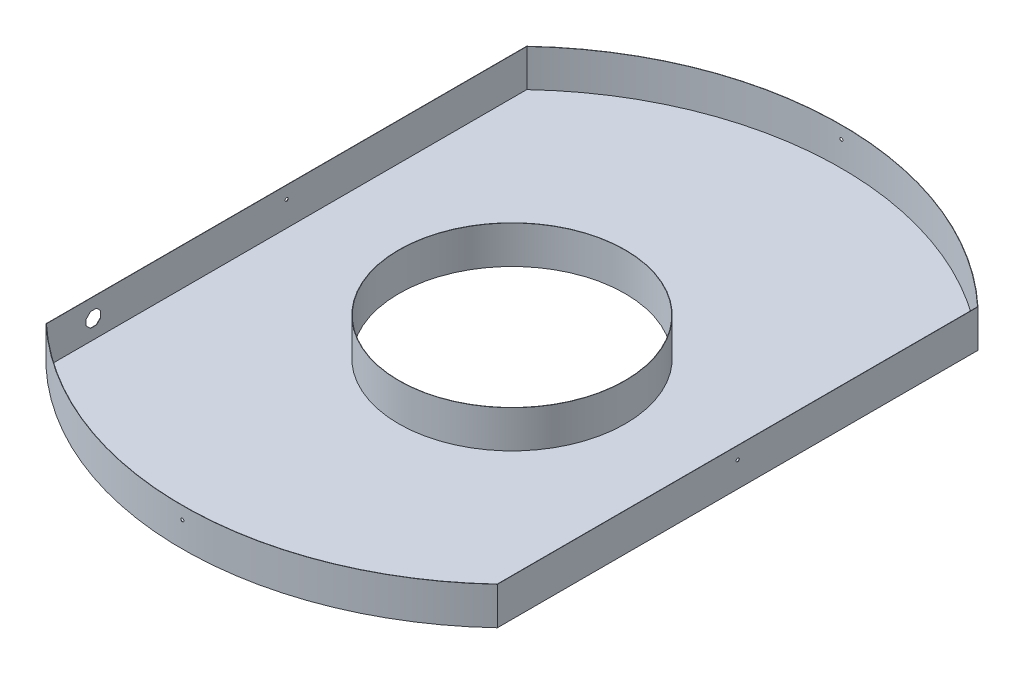
from build123d import *

# Parameters (mm, degrees)
SKETCH1_R                = 1750
BOSS_EXTRUDE1_DEPTH      = 500
SKETCH2_R                = 900
CUT_EXTRUDE2_DEPTH       = 300
CUT_EXTRUDE10_DEPTH      = 2525.876234591
CUT_EXTRUDE10_DEPTH_BACK = 2525.876234591
SKETCH10_W               = 4401.17604026
SKETCH10_H               = 5623.086471134
SKETCH10_W_2             = 2396.119838962
SKETCH10_H_2             = 4339.917258658
SKETCH3_R                = 600
CUT_EXTRUDE3_DEPTH       = 300
SHELL1_T                 = -1.5
SKETCH11_W               = 3093.35758239
SKETCH11_H               = 4860.990486612
CUT_EXTRUDE11_DEPTH      = 2142.92613567
SKETCH7_R                = 8.382
CUT_EXTRUDE6_DEPTH       = 900
CIRPATTERN1_COUNT        = 4
CUT_EXTRUDE13_DEPTH      = 10
SKETCH13_R               = 901.5
SKETCH13_R_2             = 601.5
CUT_EXTRUDE14_DEPTH      = 10


with BuildPart() as part:
    # Sketch1 → Boss-Extrude1 (new body)
    with BuildSketch(Plane(origin=(0, 0, 0), x_dir=(1, 0, 0), z_dir=(0, 1, 0))):
        Circle(SKETCH1_R)
    extrude(amount=BOSS_EXTRUDE1_DEPTH)

    # Sketch2 → Cut-Extrude2 (cut)
    with BuildSketch(Plane(origin=(0, 500, 0), x_dir=(1, 0, 0), z_dir=(0, 1, 0))):
        Circle(SKETCH2_R)
    extrude(amount=-CUT_EXTRUDE2_DEPTH, mode=Mode.SUBTRACT)

    # Sketch10 → Cut-Extrude10 (cut, two sides: drawn at the far end of the back side and taken through both)
    with BuildSketch(Plane(origin=(0, 500, 0), x_dir=(1, 0, 0), z_dir=(0, 1, 0)).offset(-CUT_EXTRUDE10_DEPTH_BACK)):
        Rectangle(SKETCH10_W, SKETCH10_H)
        Rectangle(SKETCH10_W_2, SKETCH10_H_2, mode=Mode.SUBTRACT)
    extrude(amount=CUT_EXTRUDE10_DEPTH + CUT_EXTRUDE10_DEPTH_BACK, mode=Mode.SUBTRACT)

    # Sketch3 → Cut-Extrude3 (cut)
    with BuildSketch(Plane.XZ):
        Circle(SKETCH3_R)
    extrude(amount=-CUT_EXTRUDE3_DEPTH, mode=Mode.SUBTRACT)

    # Shell1
    shell1_openings = [part.faces().sort_by_distance(p)[0] for p in [
        (1155.643660473, 500, 0),
    ]]
    offset(amount=SHELL1_T, openings=shell1_openings, kind=Kind.INTERSECTION)

    # Sketch11 → Cut-Extrude11 (cut, through all)
    with BuildSketch(Plane(origin=(0, 200, 0), x_dir=(1, 0, 0), z_dir=(0, 1, 0))):
        Rectangle(SKETCH11_W, SKETCH11_H)
    extrude(amount=CUT_EXTRUDE11_DEPTH, mode=Mode.SUBTRACT)

    # Sketch7 → Cut-Extrude6 (cut)
    with BuildSketch(Plane.XY.offset(2000)):
        with Locations((0, 133.897639423)):
            Circle(SKETCH7_R)
    cut_extrude6 = extrude(amount=-CUT_EXTRUDE6_DEPTH, mode=Mode.SUBTRACT)

    # CirPattern1: Cut-Extrude6 ×4 about axis
    cirpattern1_axis = Axis((0, 500, 0), (0, -1, 0))
    for i in range(1, CIRPATTERN1_COUNT):
        add(cut_extrude6.rotate(cirpattern1_axis, i * 360 / CIRPATTERN1_COUNT), mode=Mode.SUBTRACT)

    # Sketch12 → Cut-Extrude13 (cut)
    with BuildSketch(Plane.ZY.offset(1198.059919481)):
        Polygon((986.482270432, 84.275662181), (1009.035048281, 61.722884332), (1040.929492584, 61.722884332), (1063.482270432, 84.275662181), (1063.482270432, 116.170106484), (1040.929492584, 138.722884332), (1009.035048281, 138.722884332), (986.482270432, 116.170106484), align=None)
    extrude(amount=-CUT_EXTRUDE13_DEPTH, mode=Mode.SUBTRACT)

    # Sketch13 → Cut-Extrude14 (cut)
    with BuildSketch(Plane(origin=(0, 200, 0), x_dir=(1, 0, 0), z_dir=(0, 1, 0))):
        Circle(SKETCH13_R)
        Circle(SKETCH13_R_2, mode=Mode.SUBTRACT)
    extrude(amount=-CUT_EXTRUDE14_DEPTH, mode=Mode.SUBTRACT)


solid = part.part
